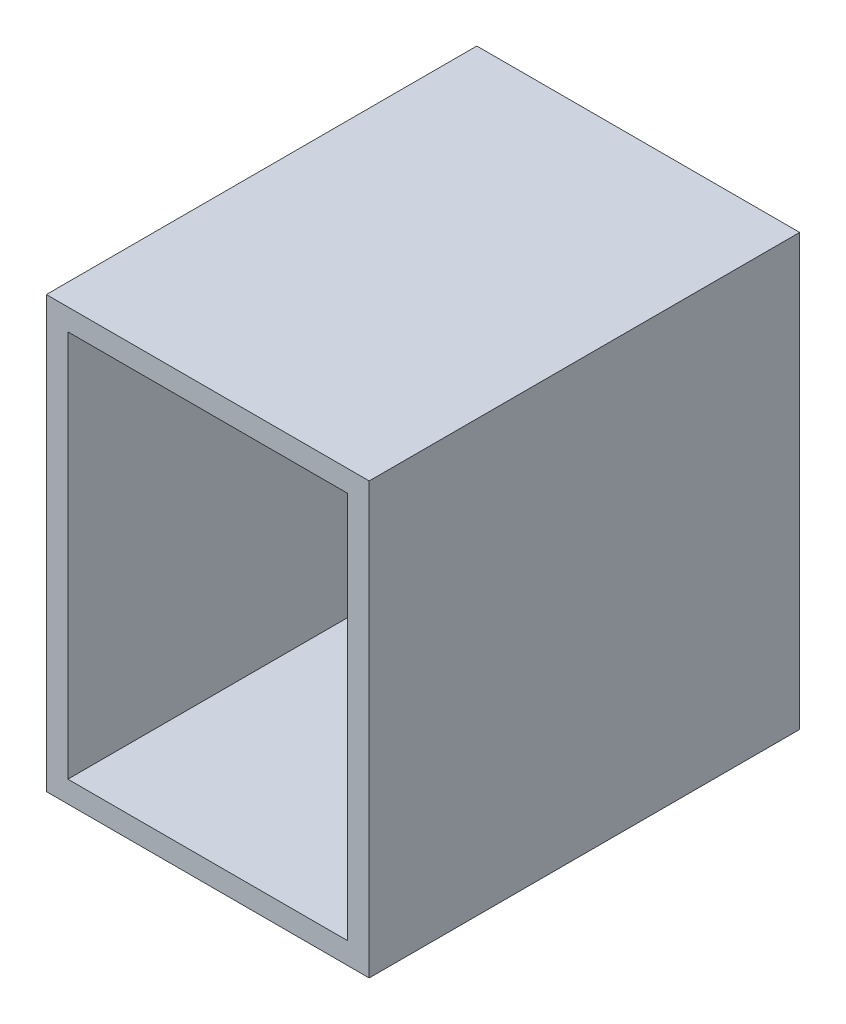
from build123d import *

# Parameters (mm, degrees)
SKETCH_1_W      = 15
SKETCH_1_H      = 20
SKETCH_1_W_2    = 13
SKETCH_1_H_2    = 18
EXTRUDE_1_DEPTH = 20


with BuildPart() as part:
    # 草图1 → 拉伸-薄壁1 (new body)
    with BuildSketch(Plane.XY):
        with Locations((7.5, -10)):
            Rectangle(SKETCH_1_W, SKETCH_1_H)
        with Locations((7.5, -10)):
            Rectangle(SKETCH_1_W_2, SKETCH_1_H_2, mode=Mode.SUBTRACT)
    extrude(amount=EXTRUDE_1_DEPTH)


solid = part.part
